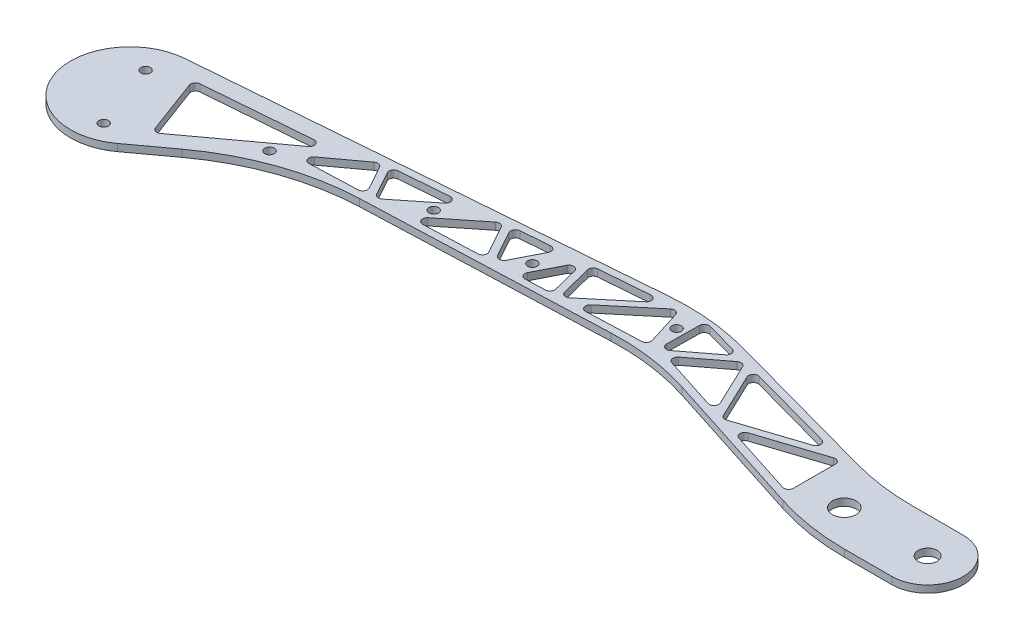
from build123d import *

# Parameters (mm, degrees)
SKETCH1_R           = 5
SKETCH1_R_2         = 4
BOSS_EXTRUDE1_DEPTH = 3
FILLET1_R           = 100
SKETCH2_R           = 2
CUT_EXTRUDE1_DEPTH  = 3
FILLET2_R           = 2


with BuildPart() as part:
    # Sketch1 → Boss-Extrude1 (new body)
    with BuildSketch(Plane(origin=(0, 0, 0), x_dir=(1, 0, 0), z_dir=(0, 1, 0))):
        with BuildLine():
            Line((-94.853395733, 15.263592787), (-8.209432186, -12.55409189))
            Line((-8.209432186, -12.55409189), (0, -15))
            Line((0, -15), (35, -15))
            ThreePointArc((35, -15), (50, 0), (35, 15))
            Line((35, 15), (0, 15))
            Line((0, 15), (-96.417851723, 41.525419301))
            Line((-96.417851723, 41.525419301), (-302.012777379, 24.918842815))
            ThreePointArc((-302.012777379, 24.918842815), (-323.422288966, -8.74050225), (-285.196078396, -20.145567878))
            Line((-285.196078396, -20.145567878), (-244.853395733, 9.500154448))
            Line((-244.853395733, 9.500154448), (-94.853395733, 15.263592787))
        make_face()
        Circle(SKETCH1_R, mode=Mode.SUBTRACT)
        with Locations((35, 0)):
            Circle(SKETCH1_R_2, mode=Mode.SUBTRACT)
    extrude(amount=BOSS_EXTRUDE1_DEPTH)

    # Fillet1
    fillet1_edges = [part.edges().sort_by_distance(p)[0] for p in [
        (0, 1.5, -15),
        (-96.417851723, 1.5, -41.525419301),
        (-94.853395733, 1.5, -15.263592787),
        (-244.853395733, 1.5, -9.500154448),
        (0, 1.5, 15),
    ]]
    fillet(fillet1_edges, radius=FILLET1_R)

    # Sketch2 → Cut-Extrude1 (cut)
    with BuildSketch(Plane(origin=(0, 3, 0), x_dir=(1, 0, 0), z_dir=(0, 1, 0))):
        with Locations((-100.410325029, 29.966674425)):
            Circle(SKETCH2_R)
        with Locations((-154.331360865, 23.327852047)):
            Circle(SKETCH2_R)
        with Locations((-194.43609766, 21.998076888)):
            Circle(SKETCH2_R)
        with Locations((-250.479012244, 9.089087069)):
            Circle(SKETCH2_R)
        with Locations((-305.880435037, 12.401187858)):
            Circle(SKETCH2_R)
        with Locations((-295.391832737, -15.705559051)):
            Circle(SKETCH2_R)
        Polygon((-292.21586201, 18.687373798), (-281.876511166, -9.019417731), (-238.23936591, 23.047232428), align=None)
        Polygon((-17.754718765, 16.773026019), (-17.754718765, -6.33868172), (-53.365436428, 5.0944023), align=None)
        Polygon((-22.990022437, 18.213305206), (-69.89582428, 31.117513703), (-58.230092835, 6.656236183), align=None)
        Polygon((-62.154702225, 7.916261025), (-73.721446188, 32.169976742), (-92.622909187, 17.698303988), align=None)
        Polygon((-77.35185331, 33.168734435), (-96.92030532, 18.186389746), (-96.703582242, 38.492569336), align=None)
        Polygon((-244.106325436, 12.531072737), (-222.617491874, 28.322089864), (-214.487999018, 13.66909539), align=None)
        Polygon((-106.555479442, 37.696799286), (-100.410325029, 18.05229299), (-131.520316701, 16.856956198), align=None)
        Polygon((-111.738383291, 37.278159142), (-136.427588937, 16.668404458), (-141.03422906, 34.911837591), align=None)
        Polygon((-144.066545636, 34.666907435), (-139.492021115, 16.550660019), (-153.569970314, 16.009744071), align=None)
        Polygon((-153.429835368, 33.910603812), (-162.727242525, 15.657894913), (-172.020743917, 32.408955151), align=None)
        Polygon((-175.304372068, 32.143725735), (-166.086412512, 15.528825786), (-197.65154914, 14.316000995), align=None)
        Polygon((-219.333863723, 28.58731928), (-211.128829032, 13.798164517), (-189.577714365, 30.990821062), align=None)
    extrude(amount=-CUT_EXTRUDE1_DEPTH, mode=Mode.SUBTRACT)

    # Fillet2
    fillet2_edges = [part.edges().sort_by_distance(p)[0] for p in [
        (-17.754718765, 1.5, 6.33868172),
        (-17.754718765, 1.5, -16.773026019),
        (-22.990022437, 1.5, -18.213305206),
        (-58.230092835, 1.5, -6.656236183),
        (-69.89582428, 1.5, -31.117513703),
        (-62.154702225, 1.5, -7.916261025),
        (-92.622909187, 1.5, -17.698303988),
        (-73.721446188, 1.5, -32.169976742),
        (-77.35185331, 1.5, -33.168734435),
        (-96.92030532, 1.5, -18.186389746),
        (-96.703582242, 1.5, -38.492569336),
        (-106.555479442, 1.5, -37.696799286),
        (-131.520316701, 1.5, -16.856956198),
        (-100.410325029, 1.5, -18.05229299),
        (-141.03422906, 1.5, -34.911837591),
        (-136.427588937, 1.5, -16.668404458),
        (-111.738383291, 1.5, -37.278159142),
        (-153.569970314, 1.5, -16.009744071),
        (-139.492021115, 1.5, -16.550660019),
        (-144.066545636, 1.5, -34.666907435),
        (-172.020743917, 1.5, -32.408955151),
        (-162.727242525, 1.5, -15.657894913),
        (-153.429835368, 1.5, -33.910603812),
        (-189.577714365, 1.5, -30.990821062),
        (-219.333863723, 1.5, -28.58731928),
        (-211.128829032, 1.5, -13.798164517),
        (-197.65154914, 1.5, -14.316000995),
        (-175.304372068, 1.5, -32.143725735),
        (-166.086412512, 1.5, -15.528825786),
        (-214.487999018, 1.5, -13.66909539),
        (-244.106325436, 1.5, -12.531072737),
        (-222.617491874, 1.5, -28.322089864),
        (-281.876511166, 1.5, 9.019417731),
        (-292.21586201, 1.5, -18.687373798),
        (-238.23936591, 1.5, -23.047232428),
        (-53.365436428, 1.5, -5.0944023),
    ]]
    fillet(fillet2_edges, radius=FILLET2_R)


solid = part.part
